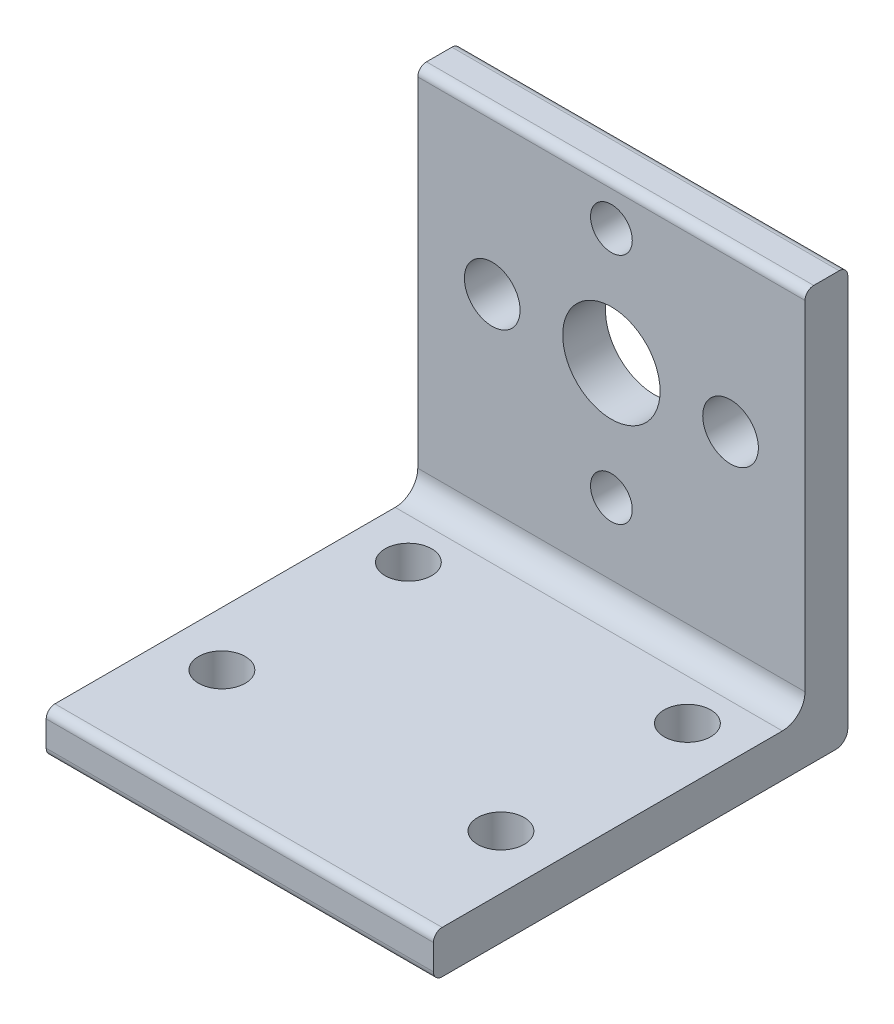
from build123d import *

# Parameters (mm, degrees)
BOSS_EXTRUDE1_DEPTH     = 28.2702
SKETCH2_R               = 3.556
SKETCH2_R_2             = 1.524
SKETCH2_R_3             = 2.032
MOTOR_MOUNT_HOLES_DEPTH = 50.437835996
SKETCH3_R               = 1.7018
PLATE_MOUNT_HOLES_DEPTH = 50.444256141
FILLET1_R               = 1.651
FILLET2_R               = 0.889
FILLET3_R               = 0.635


with BuildPart() as part:
    # Sketch1 → Boss-Extrude1 (new body)
    with BuildSketch(Plane(origin=(0, 0, 0), x_dir=(0, 0, -1), z_dir=(1, 0, 0))):
        Polygon((0, 0), (0, -30.1498), (-30.2514, -30.1498), (-30.2514, -27.0256), (-3.1242, -27.0256), (-3.1242, 0), align=None)
    extrude(amount=BOSS_EXTRUDE1_DEPTH)

    # Sketch2 → Motor_Mount_holes (cut, through all)
    with BuildSketch(Plane.XY.offset(3.1242)):
        with Locations((14.1351, -11.6586)):
            Circle(SKETCH2_R)
        with Locations((14.1351, -3.1496)):
            Circle(SKETCH2_R_2)
        with Locations((5.4356, -11.6586)):
            Circle(SKETCH2_R_3)
        with Locations((22.8346, -11.6586)):
            Circle(SKETCH2_R_3)
        with Locations((14.1351, -20.1676)):
            Circle(SKETCH2_R_2)
    extrude(amount=-MOTOR_MOUNT_HOLES_DEPTH, mode=Mode.SUBTRACT)

    # Sketch3 → Plate_Mount_Holes (cut, through all)
    with BuildSketch(Plane(origin=(0, -27.0256, 0), x_dir=(1, 0, 0), z_dir=(0, 1, 0))):
        with Locations((24.3205, -7.7597)):
            Circle(SKETCH3_R)
        with Locations((3.9497, -7.7597)):
            Circle(SKETCH3_R)
        with Locations((3.9497, -21.3741)):
            Circle(SKETCH3_R)
        with Locations((24.3205, -21.3741)):
            Circle(SKETCH3_R)
    extrude(amount=-PLATE_MOUNT_HOLES_DEPTH, mode=Mode.SUBTRACT)

    # Fillet1
    fillet1_edges = [part.edges().sort_by_distance(p)[0] for p in [
        (14.1351, -27.0256, 3.1242),
    ]]
    fillet(fillet1_edges, radius=FILLET1_R)

    # Fillet2
    fillet2_edges = [part.edges().sort_by_distance(p)[0] for p in [
        (14.1351, -30.1498, 0),
    ]]
    fillet(fillet2_edges, radius=FILLET2_R)

    # Fillet3
    fillet3_edges = [part.edges().sort_by_distance(p)[0] for p in [
        (14.1351, -30.1498, 30.2514),
        (14.1351, -27.0256, 30.2514),
        (14.1351, 0, 0),
        (14.1351, 0, 3.1242),
    ]]
    fillet(fillet3_edges, radius=FILLET3_R)


solid = part.part
